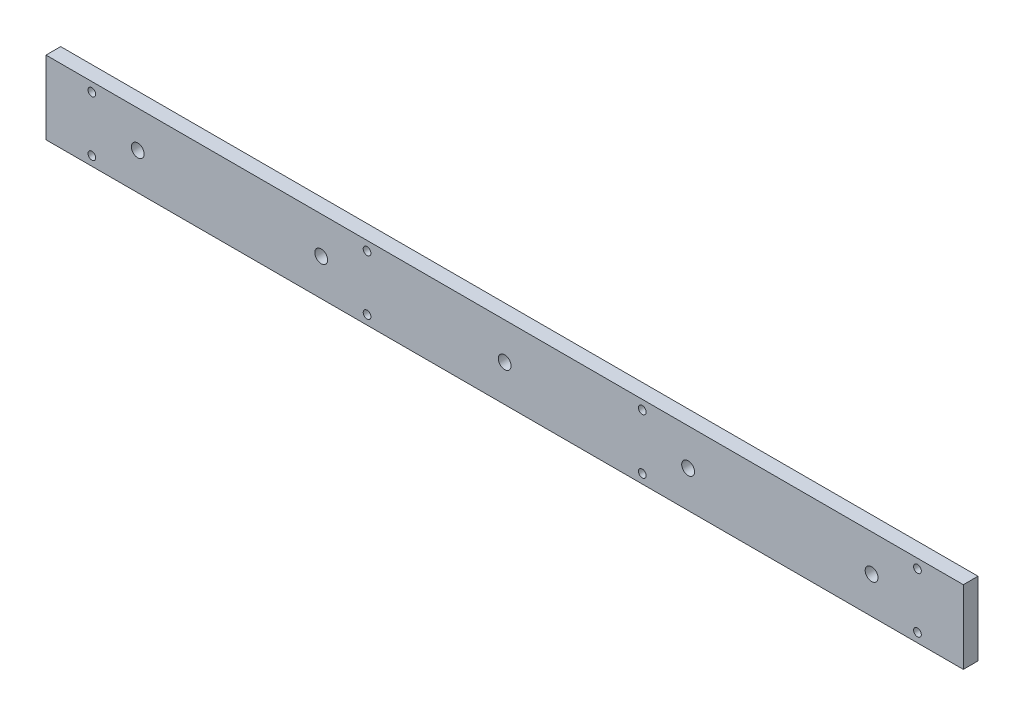
from build123d import *

# Parameters (mm, degrees)
ESQUISSE1_W                  = 500
ESQUISSE1_H                  = 40
BOSS_EXTRU_1_DEPTH           = 8
ENL_V_MAT_EXTRU_1_DEPTH      = 502.661240281
ENL_V_MAT_EXTRU_1_DEPTH_BACK = 502.661240281
ESQUISSE2_R                  = 3.5
ESQUISSE2_R_2                = 2.1


with BuildPart() as part:
    # Esquisse1 → Boss.-Extru.1 (new body)
    with BuildSketch(Plane.XY):
        with Locations((250, 20)):
            Rectangle(ESQUISSE1_W, ESQUISSE1_H)
    extrude(amount=BOSS_EXTRU_1_DEPTH)

    # Esquisse2 → Enlèv. mat.-Extru.1 (cut, two sides: drawn at the far end of the back side and taken through both)
    with BuildSketch(Plane.XY.offset(8).offset(-ENL_V_MAT_EXTRU_1_DEPTH_BACK)):
        with Locations((250, 20)):
            Circle(ESQUISSE2_R)
        with Locations((150, 20)):
            Circle(ESQUISSE2_R)
        with Locations((50, 20)):
            Circle(ESQUISSE2_R)
        with Locations((450, 20)):
            Circle(ESQUISSE2_R)
        with Locations((350, 20)):
            Circle(ESQUISSE2_R)
        with Locations((25, 35)):
            Circle(ESQUISSE2_R_2)
        with Locations((175, 35)):
            Circle(ESQUISSE2_R_2)
        with Locations((325, 35)):
            Circle(ESQUISSE2_R_2)
        with Locations((475, 35)):
            Circle(ESQUISSE2_R_2)
        with Locations((475, 5)):
            Circle(ESQUISSE2_R_2)
        with Locations((325, 5)):
            Circle(ESQUISSE2_R_2)
        with Locations((175, 5)):
            Circle(ESQUISSE2_R_2)
        with Locations((25, 5)):
            Circle(ESQUISSE2_R_2)
    extrude(amount=ENL_V_MAT_EXTRU_1_DEPTH + ENL_V_MAT_EXTRU_1_DEPTH_BACK, mode=Mode.SUBTRACT)


solid = part.part
